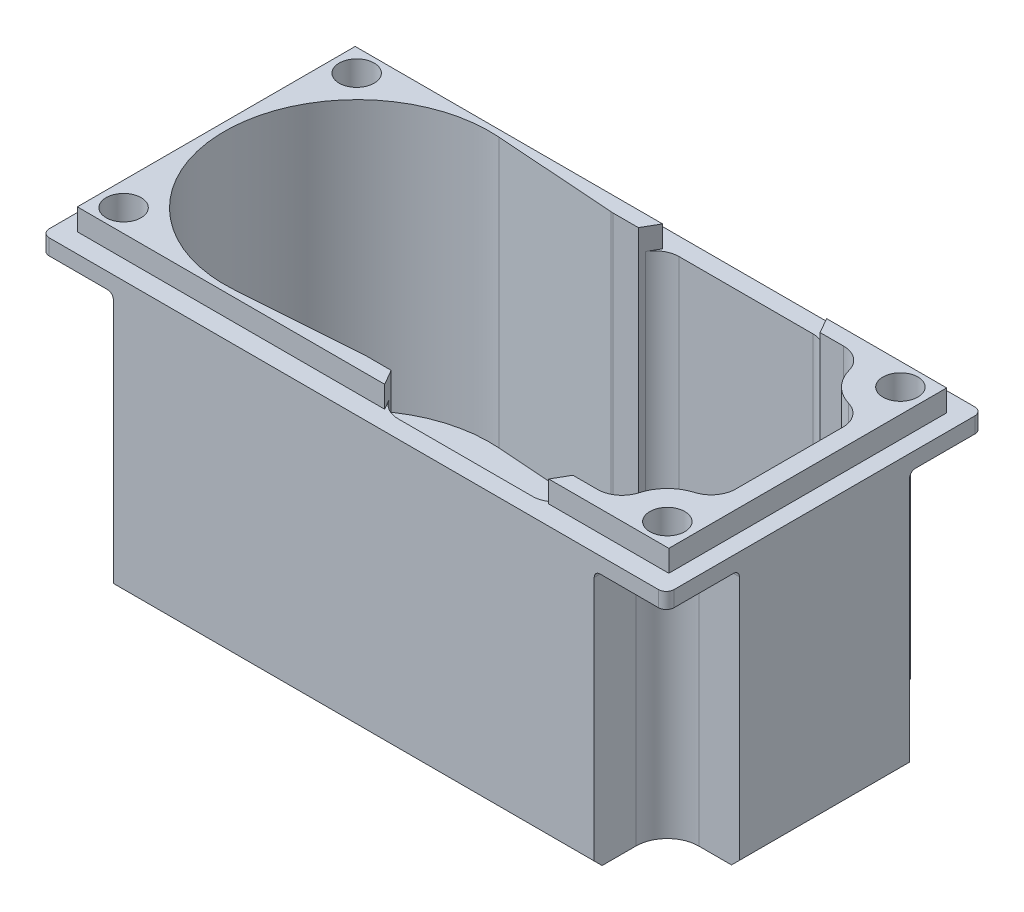
from build123d import *

# Parameters (mm, degrees)
SKETCH1_W             = 40.386
SKETCH1_H             = 20.447
BOSS_EXTRUDE1_DEPTH   = 17.78
FILLET1_R             = 0.508
CHAMFER1_SIZE         = 0.508
F_2_CLEARANCE_HOLE1_D = 2.2606
SKETCH6_R             = 8.5725
CUT_EXTRUDE1_DEPTH    = 16.002
CUT_EXTRUDE4_DEPTH    = 16.002
FILLET3_R             = 1.5875
SKETCH9_R             = 1.1303
CUT_EXTRUDE5_DEPTH    = 16.764
FILLET5_R             = 0.381
SKETCH11_R            = 7.62
CUT_EXTRUDE7_DEPTH    = 29.782036086
BOSS_EXTRUDE3_START   = 1.397
SKETCH12_W            = 38.227
SKETCH12_H            = 17.9578
SKETCH12_R            = 1.1303
BOSS_EXTRUDE3_DEPTH   = 1.397
CUT_EXTRUDE8_DEPTH    = 29.548246921
FILLET7_R             = 1.5875
CUT_EXTRUDE9_DEPTH    = 1.397


with BuildPart() as part:
    # Sketch1 → Boss-Extrude1 (new body)
    with BuildSketch(Plane(origin=(0, 0, 0), x_dir=(1, 0, 0), z_dir=(0, 1, 0))):
        Rectangle(SKETCH1_W, SKETCH1_H)
    extrude(amount=BOSS_EXTRUDE1_DEPTH)

    # Fillet1
    fillet1_edges = [part.edges().sort_by_distance(p)[0] for p in [
        (20.193, 8.89, 10.2235),
        (-20.193, 8.89, 10.2235),
        (-20.193, 8.89, -10.2235),
        (20.193, 8.89, -10.2235),
    ]]
    fillet(fillet1_edges, radius=FILLET1_R)

    # Chamfer1
    chamfer1_edges = [part.edges().sort_by_distance(p)[0] for p in [
        (20.193, 0, 0),
        (0, 0, 10.2235),
        (-20.193, 0, 0),
        (0, 0, -10.2235),
        (-20.044210245, 0, 10.074710245),
        (-20.044210245, 0, -10.074710245),
        (20.044210245, 0, -10.074710245),
        (20.044210245, 0, 10.074710245),
    ]]
    chamfer(chamfer1_edges, length=CHAMFER1_SIZE)

    # #2 Clearance Hole1 (through all)
    with Locations(Plane(origin=(0, 17.78, 0), x_dir=(1, 0, 0), z_dir=(0, 1, 0))):
        with Locations((17.57045, -7.5311), (-17.57045, 7.5311), (-17.57045, -7.5311), (17.57045, 7.5311)):
            Hole(F_2_CLEARANCE_HOLE1_D / 2)

    # Sketch6 → Cut-Extrude1 (cut)
    with BuildSketch(Plane(origin=(0, 17.78, 0), x_dir=(1, 0, 0), z_dir=(0, 1, 0))):
        with Locations(Location((-10.014739789, 0, 0), (0, 0, 270))):
            Circle(SKETCH6_R)
    extrude(amount=-CUT_EXTRUDE1_DEPTH, mode=Mode.SUBTRACT)

    # Sketch10 → Cut-Extrude4 (cut)
    with BuildSketch(Plane(origin=(0, 17.78, 0), x_dir=(1, 0, 0), z_dir=(0, 1, 0))):
        with BuildLine():
            Line((-1.45309254, -7.9883), (14.988060281, -7.9883))
            ThreePointArc((14.988060281, -7.9883), (15.691271985, -5.7017672), (17.958078801, -4.937355137))
            Line((17.958078801, -4.937355137), (17.958078801, 4.866749859))
            ThreePointArc((17.958078801, 4.866749859), (15.641892996, 5.652354237), (14.917152821, 7.9883))
            Line((14.917152821, 7.9883), (-1.524, 7.9883))
            Line((-1.524, 7.9883), (-9.404450133, 8.550748668))
            ThreePointArc((-9.404450133, 8.550748668), (-1.442240219, -0.00271347), (-9.409863426, -8.551133307))
            Line((-9.409863426, -8.551133307), (-1.45309254, -7.9883))
        make_face()
    extrude(amount=-CUT_EXTRUDE4_DEPTH, mode=Mode.SUBTRACT)

    # Fillet3
    # the kernel refuses this fillet: 1.5875 mm, written as the material it adds along each edge
    with BuildSketch(Plane(origin=(14.917152821, 17.78, -7.9883), x_dir=(-1, 0, 0), z_dir=(0, -1, 0))) as fillet3_piece_1:
        with BuildLine():
            CenterArc((1.474652181, -1.5875), FILLET3_R, 90, 74.686818151)
            ThreePointArc((-0.056486306, -1.168249258), (0.035961125, -0.587228986), (0, 0))
            Line((0, 0), (1.474652181, 0))
        make_face()
    extrude(amount=16.002)
    with BuildSketch(Plane(origin=(17.958078801, 17.78, -4.866749859), x_dir=(-0.9975619874511197, 0, -0.06978596701753238), z_dir=(0, -1, 0))) as fillet3_piece_2:
        with BuildLine():
            CenterArc((1.48286456, -1.551181233), FILLET3_R, 102.279418141, 73.718887891)
            Line((-0.100765095, -1.44039601), (0, 0))
            ThreePointArc((0, 0), (0.572618009, -0.061596629), (1.145236017, 0))
        make_face()
    extrude(amount=16.002)
    with BuildSketch(Plane(origin=(17.958078801, 17.78, 4.937355137), x_dir=(0, 0, -1), z_dir=(0, -1, 0))) as fillet3_piece_3:
        with BuildLine():
            CenterArc((1.441701842, -1.5875), FILLET3_R, 90, 73.441052757)
            ThreePointArc((-0.079959812, -1.13505988), (0.022321973, -0.571918824), (0, 0))
            Line((0, 0), (1.441701842, 0))
        make_face()
    extrude(amount=16.002)
    with BuildSketch(Plane(origin=(14.988060281, 17.78, 7.9883), x_dir=(0.048272098089337995, 0, -0.9988342227547339), z_dir=(0, -1, 0))) as fillet3_piece_4:
        with BuildLine():
            CenterArc((1.514540022, -1.548008005), FILLET3_R, 102.806774289, 74.426362957)
            Line((-0.071109307, -1.47137605), (0, 0))
            ThreePointArc((0, 0), (0.581324376, -0.065240775), (1.162648753, 0))
        make_face()
    extrude(amount=16.002)
    # the kernel refuses this fillet: 1.5875 mm, written as the material it takes off along each edge
    with BuildSketch(Plane(origin=(-1.524, 17.921450207, -7.9883), x_dir=(-0.9974626617850719, 0, -0.0711915609088555), z_dir=(0, -1, 0))) as fillet3_2_piece_1:
        with BuildLine():
            CenterArc((FILLET3_R * 0.0356409970864, FILLET3_R), FILLET3_R, 265.917570604, 4.082429396)
            Line((-FILLET3_R * 0.0355505638225, FILLET3_R * 0.00253733821493), (0, 0))
            Line((0, 0), (FILLET3_R * 0.0356409970864, 0))
        make_face()
    extrude(amount=16.143450207, mode=Mode.SUBTRACT)
    with BuildSketch(Plane(origin=(-1.45309254, 17.920192389, 7.9883), x_dir=(-0.9975075307142005, 0, 0.07056008906214724), z_dir=(0, -1, 0))) as fillet3_2_piece_2:
        with BuildLine():
            CenterArc((FILLET3_R * 0.0353240666066, -FILLET3_R), FILLET3_R, 90, 4.046157505)
            Line((-FILLET3_R * 0.0352360224555, -FILLET3_R * 0.0024924692858), (0, 0))
            Line((0, 0), (FILLET3_R * 0.0353240666066, 0))
        make_face()
    extrude(amount=16.142192389, mode=Mode.SUBTRACT)

    # Sketch9 → Cut-Extrude5 (cut)
    # profile 1 of 8: a face of its own
    with BuildSketch(Plane.XZ):
        with BuildLine():
            Line((-19.685, 9.7155), (-19.685, 5.4991))
            Line((-19.685, 5.4991), (-17.57045, 5.4991))
            ThreePointArc((-17.57045, 5.4991), (-16.133609021, 6.094259021), (-15.53845, 7.5311))
            Line((-15.53845, 7.5311), (-15.53845, 9.7155))
            Line((-15.53845, 9.7155), (-19.685, 9.7155))
        make_face()
        with Locations(Location((-17.57045, 7.5311, 0), (0, 0, 90))):
            Circle(SKETCH9_R, mode=Mode.SUBTRACT)
    # profile 2 of 8: a face of its own
    with BuildSketch(Plane.XZ):
        with BuildLine():
            Line((-20.193, 5.4991), (-19.685, 5.4991))
            Line((-19.685, 5.4991), (-19.685, 9.7155))
            Line((-19.685, 9.7155), (-15.53845, 9.7155))
            Line((-15.53845, 9.7155), (-15.53845, 10.2235))
            Line((-15.53845, 10.2235), (-19.685, 10.2235))
            ThreePointArc((-19.685, 10.2235), (-20.044210245, 10.074710245), (-20.193, 9.7155))
            Line((-20.193, 9.7155), (-20.193, 5.4991))
        make_face()
    # profile 3 of 8: a face of its own
    with BuildSketch(Plane.XZ):
        with BuildLine():
            ThreePointArc((-15.53845, -7.5311), (-16.133609021, -6.094259021), (-17.57045, -5.4991))
            Line((-17.57045, -5.4991), (-19.685, -5.4991))
            Line((-19.685, -5.4991), (-19.685, -9.7155))
            Line((-19.685, -9.7155), (-15.53845, -9.7155))
            Line((-15.53845, -9.7155), (-15.53845, -7.5311))
        make_face()
        with Locations(Location((-17.57045, -7.5311, 0), (0, 0, 90))):
            Circle(SKETCH9_R, mode=Mode.SUBTRACT)
    # profile 4 of 8: a face of its own
    with BuildSketch(Plane.XZ):
        with BuildLine():
            Line((-19.685, -9.7155), (-19.685, -5.4991))
            Line((-19.685, -5.4991), (-20.193, -5.4991))
            Line((-20.193, -5.4991), (-20.193, -9.7155))
            ThreePointArc((-20.193, -9.7155), (-20.044210245, -10.074710245), (-19.685, -10.2235))
            Line((-19.685, -10.2235), (-15.53845, -10.2235))
            Line((-15.53845, -10.2235), (-15.53845, -9.7155))
            Line((-15.53845, -9.7155), (-19.685, -9.7155))
        make_face()
    # profile 5 of 8: a face of its own
    with BuildSketch(Plane.XZ):
        with BuildLine():
            Line((19.685, 9.7155), (15.53845, 9.7155))
            Line((15.53845, 9.7155), (15.53845, 7.5311))
            ThreePointArc((15.53845, 7.5311), (16.133609021, 6.094259021), (17.57045, 5.4991))
            Line((17.57045, 5.4991), (19.685, 5.4991))
            Line((19.685, 5.4991), (19.685, 9.7155))
        make_face()
        with Locations(Location((17.57045, 7.5311, 0), (0, 0, 90))):
            Circle(SKETCH9_R, mode=Mode.SUBTRACT)
    # profile 6 of 8: a face of its own
    with BuildSketch(Plane.XZ):
        with BuildLine():
            Line((15.53845, 10.2235), (15.53845, 9.7155))
            Line((15.53845, 9.7155), (19.685, 9.7155))
            Line((19.685, 9.7155), (19.685, 5.4991))
            Line((19.685, 5.4991), (20.193, 5.4991))
            Line((20.193, 5.4991), (20.193, 9.7155))
            ThreePointArc((20.193, 9.7155), (20.044210245, 10.074710245), (19.685, 10.2235))
            Line((19.685, 10.2235), (15.53845, 10.2235))
        make_face()
    # profile 7 of 8: a face of its own
    with BuildSketch(Plane.XZ):
        with BuildLine():
            Line((15.53845, -7.5311), (15.53845, -9.7155))
            Line((15.53845, -9.7155), (19.685, -9.7155))
            Line((19.685, -9.7155), (19.685, -5.4991))
            Line((19.685, -5.4991), (17.57045, -5.4991))
            ThreePointArc((17.57045, -5.4991), (16.133609021, -6.094259021), (15.53845, -7.5311))
        make_face()
        with Locations(Location((17.57045, -7.5311, 0), (0, 0, 90))):
            Circle(SKETCH9_R, mode=Mode.SUBTRACT)
    # profile 8 of 8: a face of its own
    with BuildSketch(Plane.XZ):
        with BuildLine():
            Line((19.685, -9.7155), (15.53845, -9.7155))
            Line((15.53845, -9.7155), (15.53845, -10.2235))
            Line((15.53845, -10.2235), (19.685, -10.2235))
            ThreePointArc((19.685, -10.2235), (20.044210245, -10.074710245), (20.193, -9.7155))
            Line((20.193, -9.7155), (20.193, -5.4991))
            Line((20.193, -5.4991), (19.685, -5.4991))
            Line((19.685, -5.4991), (19.685, -9.7155))
        make_face()
    extrude(amount=-CUT_EXTRUDE5_DEPTH, mode=Mode.SUBTRACT)

    # Fillet5
    fillet5_edges = [part.edges().sort_by_distance(p)[0] for p in [
        (-16.133609021, 16.764, -6.094259021),
        (-18.881725, 16.764, -5.4991),
        (-15.53845, 16.764, -8.8773),
        (16.133609021, 16.764, 6.094259021),
        (18.881725, 16.764, 5.4991),
        (15.53845, 16.764, 8.8773),
        (16.133609021, 16.764, -6.094259021),
        (15.53845, 16.764, -8.8773),
        (18.881725, 16.764, -5.4991),
        (-16.133609021, 16.764, 6.094259021),
        (-15.53845, 16.764, 8.8773),
        (-18.881725, 16.764, 5.4991),
    ]]
    fillet(fillet5_edges, radius=FILLET5_R)

    # Sketch11 → Cut-Extrude7 (cut, through all)
    with BuildSketch(Plane.XZ):
        with Locations(Location((6.051828801, 0, 0), (0, 0, 270))):
            Circle(SKETCH11_R)
    extrude(amount=-CUT_EXTRUDE7_DEPTH, mode=Mode.SUBTRACT)

    # Sketch12 → Boss-Extrude3 (add)
    with BuildSketch(Plane(origin=(0, 17.78, 0), x_dir=(1, 0, 0), z_dir=(0, 1, 0)).offset(BOSS_EXTRUDE3_START)):
        Rectangle(SKETCH12_W, SKETCH12_H)
        with Locations(Location((17.57045, -7.5311, 0), (0, 0, 270))):
            Circle(SKETCH12_R, mode=Mode.SUBTRACT)
        with Locations(Location((17.57045, 7.5311, 0), (0, 0, 270))):
            Circle(SKETCH12_R, mode=Mode.SUBTRACT)
        with Locations(Location((-17.57045, -7.5311, 0), (0, 0, 270))):
            Circle(SKETCH12_R, mode=Mode.SUBTRACT)
        with Locations(Location((-17.57045, 7.5311, 0), (0, 0, 270))):
            Circle(SKETCH12_R, mode=Mode.SUBTRACT)
        with BuildLine():
            Line((17.958078801, -3.495653295), (17.958078801, 3.422833563))
            ThreePointArc((17.958078801, 3.422833563), (17.640752565, 4.375101834), (16.815634884, 4.946671262))
            ThreePointArc((16.815634884, 4.946671262), (15.6506227, 5.643434538), (14.973639127, 6.820050742))
            ThreePointArc((14.973639127, 6.820050742), (14.405463697, 7.662884942), (13.44250064, 7.9883))
            Line((13.44250064, 7.9883), (-1.467419917, 7.9883))
            ThreePointArc((-1.467419917, 7.9883), (-1.523964098, 7.989307326), (-1.58043652, 7.992328024))
            Line((-1.58043652, 7.992328024), (-9.404450133, 8.550748668))
            ThreePointArc((-9.404450133, 8.550748668), (-18.58723936, 0.00271347), (-9.409863426, -8.551133307))
            Line((-9.409863426, -8.551133307), (-1.509029726, -7.992256795))
            ThreePointArc((-1.509029726, -7.992256795), (-1.453057587, -7.989289507), (-1.397015585, -7.9883))
            Line((-1.397015585, -7.9883), (13.514966932, -7.9883))
            ThreePointArc((13.514966932, -7.9883), (14.475058911, -7.665070399), (15.044183775, -6.827006637))
            ThreePointArc((15.044183775, -6.827006637), (15.70015069, -5.692690635), (16.823018922, -5.017314948))
            ThreePointArc((16.823018922, -5.017314948), (17.64305767, -4.444839146), (17.958078801, -3.495653295))
        make_face(mode=Mode.SUBTRACT)
    extrude(amount=-BOSS_EXTRUDE3_DEPTH)

    # Sketch13 → Cut-Extrude8 (cut, through all)
    with BuildSketch(Plane(origin=(0, 1.778, 0), x_dir=(1, 0, 0), z_dir=(0, 1, 0))):
        Polygon((11.294457921, -9.0805), (16.53708704, 0), (11.294457921, 9.0805), (0.809199682, 9.0805), (-4.433429437, 0), (0.809199682, -9.0805), align=None)
    extrude(amount=CUT_EXTRUDE8_DEPTH, mode=Mode.SUBTRACT)

    # Fillet7
    fillet7_edges = [part.edges().sort_by_distance(p)[0] for p in [
        (0.809199682, 9.779, -9.0805),
        (11.294457921, 9.779, -9.0805),
        (11.294457921, 9.779, 9.0805),
        (0.809199682, 9.779, 9.0805),
    ]]
    fillet(fillet7_edges, radius=FILLET7_R)

    # Sketch14 → Cut-Extrude9 (cut)
    with BuildSketch(Plane(origin=(0, 19.177, 0), x_dir=(1, 0, 0), z_dir=(0, 1, 0))):
        Polygon((11.294457921, 9.0805), (0.809199682, 9.0805), (-4.433429437, 0), (0.809199682, -9.0805), (11.294457921, -9.0805), (16.53708704, 0), align=None)
    extrude(amount=-CUT_EXTRUDE9_DEPTH, mode=Mode.SUBTRACT)


solid = part.part
